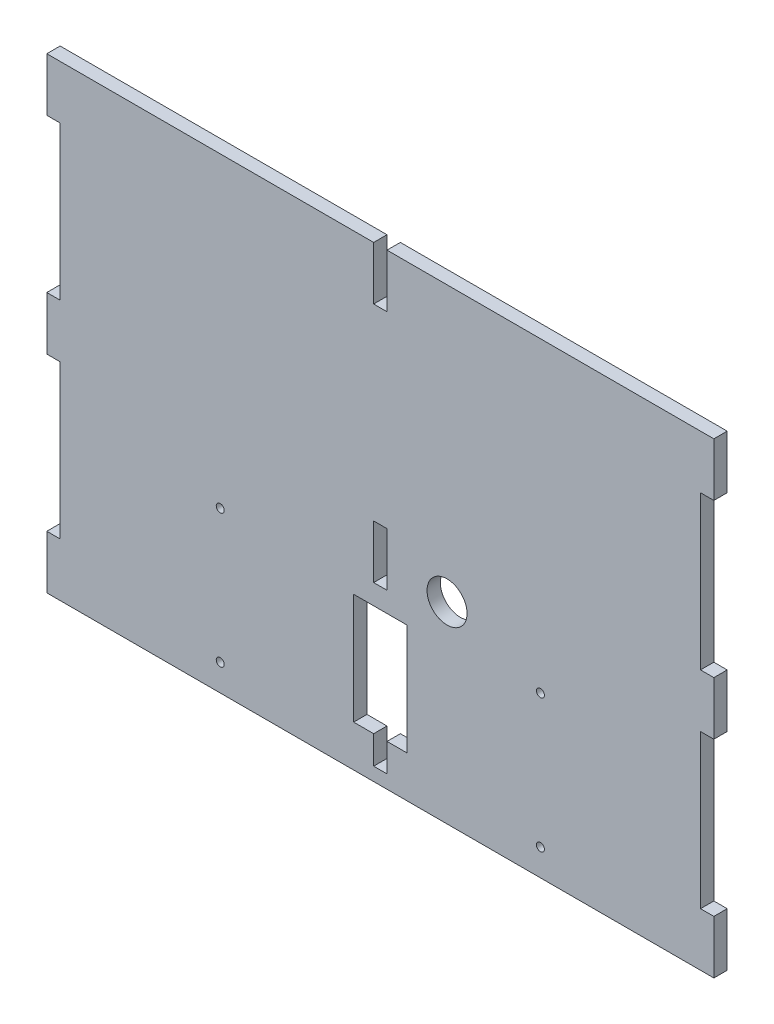
from build123d import *

# Parameters (mm, degrees)
BOSS_EXTRU_1_OUTLINE_W  = 5
BOSS_EXTRU_1_OUTLINE_H  = 20
BOSS_EXTRU_1_DEPTH      = 5
ESQUISSE2_R             = 1.5
ENL_V_MAT_EXTRU_1_DEPTH = 229.322140845
ESQUISSE3_R             = 7.5
ENL_V_MAT_EXTRU_2_DEPTH = 229.322140845


# Read off the part's stored shape, not the designer's step: Boss.-Extru.1
with BuildPart() as part:
    # Boss.-Extru.1 outline → Boss.-Extru.1 (new body)
    with BuildSketch(Plane.XY):
        Polygon((125, -16), (2.5, -16), (2.5, -36), (-2.5, -36), (-2.5, -16), (-125, -16), (-125, -36), (-120, -36), (-120, -93.5), (-125, -93.5), (-125, -113.5), (-120, -113.5), (-120, -171), (-125, -171), (-125, -191), (125, -191), (125, -171), (120, -171), (120, -113.5), (125, -113.5), (125, -93.5), (120, -93.5), (120, -36), (125, -36), align=None)
        Polygon((10, -133.95), (10, -175.45), (2.5, -175.45), (2.5, -186), (-2.5, -186), (-2.5, -175.45), (-10, -175.45), (-10, -133.95), align=None, mode=Mode.SUBTRACT)
        with Locations((0, -116.4)):
            Rectangle(BOSS_EXTRU_1_OUTLINE_W, BOSS_EXTRU_1_OUTLINE_H, mode=Mode.SUBTRACT)
    extrude(amount=BOSS_EXTRU_1_DEPTH)

    # Esquisse2 → Enlèv. mat.-Extru.1 (cut, through all)
    with BuildSketch(Plane.XY.offset(5)):
        with Locations((60, -131)):
            Circle(ESQUISSE2_R)
        with Locations((60, -181)):
            Circle(ESQUISSE2_R)
        with Locations(Location((-60, -131, 0), (0, 0, 180))):
            Circle(ESQUISSE2_R)
        with Locations(Location((-60, -181, 0), (0, 0, 180))):
            Circle(ESQUISSE2_R)
    extrude(amount=-ENL_V_MAT_EXTRU_1_DEPTH, mode=Mode.SUBTRACT)

    # Esquisse3 → Enlèv. mat.-Extru.2 (cut, through all)
    with BuildSketch(Plane.XY.offset(5)):
        with Locations((25, -118.95)):
            Circle(ESQUISSE3_R)
    extrude(amount=-ENL_V_MAT_EXTRU_2_DEPTH, mode=Mode.SUBTRACT)


solid = part.part
